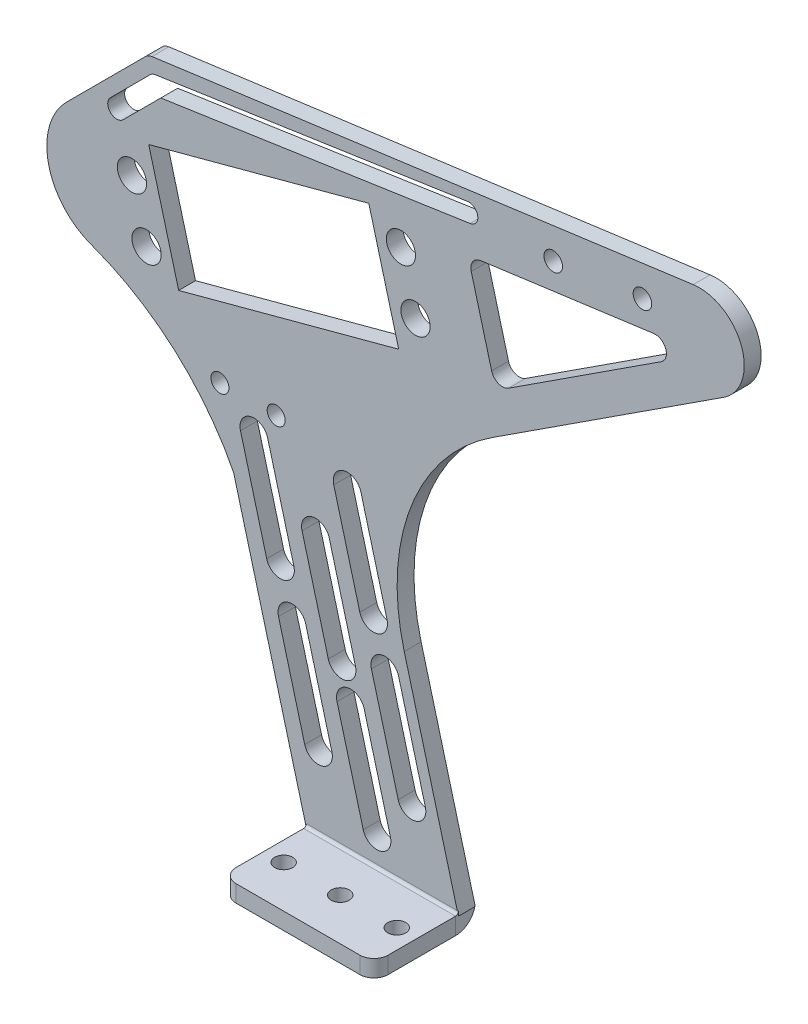
from build123d import *

# Parameters (mm, degrees)
EXTRUDE_1_DEPTH              = 3
EXTRUDE_2_DEPTH              = 120
CUT_EXTRUDE_1_DEPTH          = 195.561044405
CUT_EXTRUDE_2_DEPTH          = 152.697989965
SKETCH_9_R                   = 0.555167329
CUT_EXTRUDE_3_DEPTH          = 10
HOLE_WIZARD_M5_1_D           = 4.2
HOLE_WIZARD_M5_1_DEPTH       = 12.4
HOLE_WIZARD_M5_1_CSINK_D     = 5.05
HOLE_WIZARD_M5_1_CSINK_ANGLE = 90
HOLE_WIZARD_M5_1_TIP         = 1.2618073
SKETCH_12_R                  = 0.419228838
SKETCH_12_R_2                = 0.457437139
CUT_EXTRUDE_4_DEPTH          = 10
HOLE_WIZARD_M3_1_D           = 2.5
HOLE_WIZARD_M3_1_DEPTH       = 7.5
HOLE_WIZARD_M3_1_CSINK_D     = 3.05
HOLE_WIZARD_M3_1_CSINK_ANGLE = 90
HOLE_WIZARD_M3_1_TIP         = 0.751075774
SKETCH_31_W                  = 27
SKETCH_31_H                  = 3
CUT_EXTRUDE_7_DEPTH          = 18
SM_BASE_FLANGE_4_DEPTH       = 27
CUT_EXTRUDE_8_DEPTH          = 18
SKETCH_42_R                  = 1.6
SKETCH_42_R_2                = 2.6
CUT_EXTRUDE_9_DEPTH          = 18
SKETCH_43_R                  = 1.65
CUT_EXTRUDE_10_DEPTH         = 18
CUT_EXTRUDE_11_DEPTH         = 10
CUT_EXTRUDE_12_DEPTH         = 152.697989965
CUT_EXTRUDE_13_DEPTH         = 152.697989965


# Sheet-metal steps are written as plain solids
with BuildPart() as part:
    # 草图2 → 凸台-拉伸1 (new body)
    with BuildSketch(Plane(origin=(0, 0, 0), x_dir=(1, 0, 0), z_dir=(0, 1, 0))):
        with BuildLine():
            Line((0, 0), (27, 0))
            Line((27, 0), (27, -16))
            ThreePointArc((27, -16), (26.414213562, -17.414213562), (25, -18))
            Line((25, -18), (2, -18))
            ThreePointArc((2, -18), (0.585786438, -17.414213562), (0, -16))
            Line((0, -16), (0, 0))
        make_face()
    extrude(amount=EXTRUDE_1_DEPTH)

    # 草图3 → 凸台-拉伸2 (add)
    with BuildSketch(Plane(origin=(0, 3, 0), x_dir=(1, 0, 0), z_dir=(0, 1, 0))):
        Polygon((0, 0), (150, 0), (150, -3), (-100, -3), (-100, 0), align=None)
    extrude(amount=EXTRUDE_2_DEPTH)

    # 草图4 → 切除-拉伸1 (cut, through all)
    with BuildSketch(Plane.XY.offset(3)):
        with BuildLine():
            Line((-27.465625599, 108.090395999), (81.955038276, 122.874558425))
            ThreePointArc((81.955038276, 122.874558425), (87.311898998, 119.659835192), (85.350748847, 113.728200311))
            Line((85.350748847, 113.728200311), (33.001315422, 79.678206183))
            ThreePointArc((33.001315422, 79.678206183), (18.570908538, 61.838352676), (17.374177378, 38.924059091))
            Line((17.374177378, 38.924059091), (27, 3))
            Line((27, 3), (150, 3))
            Line((150, 3), (150, 123))
            Line((150, 123), (-100, 123))
            Line((-100, 123), (-100, 3))
            Line((-100, 3), (0, 3))
            Line((0, 3), (-12.940952255, 51.296291314))
            ThreePointArc((-12.940952255, 51.296291314), (-23.474992402, 64.922058411), (-38.267104772, 73.743676313))
            ThreePointArc((-38.267104772, 73.743676313), (-45.866257029, 82.424841396), (-42.634405947, 93.500259258))
            Line((-42.634405947, 93.500259258), (-28.612046307, 107.522618899))
            ThreePointArc((-28.612046307, 107.522618899), (-28.085458288, 107.900644409), (-27.465625599, 108.090395999))
        make_face()
    extrude(amount=-CUT_EXTRUDE_1_DEPTH, mode=Mode.SUBTRACT)

    # Sketch 8 → 切除-拉伸2 (cut, through all)
    with BuildSketch(Plane.XY.offset(3)):
        with BuildLine():
            Line((11.543452853, 33.329610255), (16.299102923, 15.581282572))
            ThreePointArc((16.299102923, 15.581282572), (19.360965101, 13.813515619), (21.128732054, 16.875377797))
            Line((21.128732054, 16.875377797), (16.373081985, 34.623705481))
            ThreePointArc((16.373081985, 34.623705481), (13.311219806, 36.391472434), (11.543452853, 33.329610255))
        make_face()
        with BuildLine():
            Line((-11.73043783, 58.369699894), (-7.071695019, 40.983035021))
            ThreePointArc((-7.071695019, 40.983035021), (-4.00983284, 39.215268068), (-2.242065887, 42.277130246))
            Line((-2.242065887, 42.277130246), (-6.900808699, 59.663795119))
            ThreePointArc((-6.900808699, 59.663795119), (-9.962670878, 61.431562072), (-11.73043783, 58.369699894))
        make_face()
        with BuildLine():
            Line((-4.972512404, 33.14877885), (-0.313769593, 15.762113977))
            ThreePointArc((-0.313769593, 15.762113977), (2.748092586, 13.994347024), (4.515859539, 17.056209202))
            Line((4.515859539, 17.056209202), (-0.142883273, 34.442874076))
            ThreePointArc((-0.142883273, 34.442874076), (-3.204745451, 36.210641028), (-4.972512404, 33.14877885))
        make_face()
        with BuildLine():
            Line((-0.784084289, 48.426978761), (3.876036229, 31.035172218))
            ThreePointArc((3.876036229, 31.035172218), (6.937898407, 29.267405265), (8.70566536, 32.329267444))
            Line((8.70566536, 32.329267444), (4.045544842, 49.721073986))
            ThreePointArc((4.045544842, 49.721073986), (0.983682664, 51.488840939), (-0.784084289, 48.426978761))
        make_face()
        with BuildLine():
            Line((4.846248155, 58.323918457), (9.480456769, 41.028816457))
            ThreePointArc((9.480456769, 41.028816457), (12.542318947, 39.261049504), (14.3100859, 42.322911683))
            Line((14.3100859, 42.322911683), (9.675877286, 59.618013683))
            ThreePointArc((9.675877286, 59.618013683), (6.614015108, 61.385780636), (4.846248155, 58.323918457))
        make_face()
        with BuildLine():
            Line((5.4289505, 25.23961726), (10.087693311, 7.852952387))
            ThreePointArc((10.087693311, 7.852952387), (13.14955549, 6.085185434), (14.917322443, 9.147047613))
            Line((14.917322443, 9.147047613), (10.258579631, 26.533712486))
            ThreePointArc((10.258579631, 26.533712486), (7.196717453, 28.301479439), (5.4289505, 25.23961726))
        make_face()
    extrude(amount=-CUT_EXTRUDE_2_DEPTH, mode=Mode.SUBTRACT)

    # 草图9 → 切除-拉伸3 (cut)
    with BuildSketch(Plane.XY.offset(3)):
        with Locations((-28.427787155, 78.364928444)):
            Circle(SKETCH_9_R)
        with Locations((-31.021767983, 88.02263332)):
            Circle(SKETCH_9_R)
        with Locations((19.37785198, 91.205133539)):
            Circle(SKETCH_9_R)
        with Locations((16.783871152, 100.862838415)):
            Circle(SKETCH_9_R)
        Polygon((-22.719980027, 74.461924756), (-28.037640723, 94.260219752), (11.076064024, 104.765842103), (16.39372472, 84.967547107), align=None)
    extrude(amount=-CUT_EXTRUDE_3_DEPTH, mode=Mode.SUBTRACT)

    # M5 螺纹孔1
    with Locations(Plane.XY.offset(3)):
        with Locations((-31.021767983, 88.02263332), (-28.427787155, 78.364928444), (16.783871152, 100.862838415), (19.37785198, 91.205133539)):
            CounterSinkHole(HOLE_WIZARD_M5_1_D / 2, HOLE_WIZARD_M5_1_CSINK_D / 2, depth=HOLE_WIZARD_M5_1_DEPTH, counter_sink_angle=HOLE_WIZARD_M5_1_CSINK_ANGLE)
            with Locations((0, 0, -(HOLE_WIZARD_M5_1_DEPTH + HOLE_WIZARD_M5_1_TIP / 2))):  # 118° drill point
                Cone(0, HOLE_WIZARD_M5_1_D / 2, HOLE_WIZARD_M5_1_TIP, mode=Mode.SUBTRACT)

    # 草图12 → 切除-拉伸4 (cut)
    with BuildSketch(Plane.XY.offset(3)):
        with Locations((-5.383085829, 63.900528175)):
            Circle(SKETCH_12_R)
        with Locations((-15.383085829, 63.900528175)):
            Circle(SKETCH_12_R_2)
        Polygon((-27.731348581, 94.083626651), (10.899470923, 104.45954996), (16.087432577, 85.144140208), (-22.543386926, 74.768216899), align=None)
    extrude(amount=-CUT_EXTRUDE_4_DEPTH, mode=Mode.SUBTRACT)

    # M3 螺纹孔1
    with Locations(Plane.XY.offset(3)):
        with Locations((-15.383085829, 63.900528175), (-5.383085829, 63.900528175)):
            CounterSinkHole(HOLE_WIZARD_M3_1_D / 2, HOLE_WIZARD_M3_1_CSINK_D / 2, depth=HOLE_WIZARD_M3_1_DEPTH, counter_sink_angle=HOLE_WIZARD_M3_1_CSINK_ANGLE)
            with Locations((0, 0, -(HOLE_WIZARD_M3_1_DEPTH + HOLE_WIZARD_M3_1_TIP / 2))):  # 118° drill point
                Cone(0, HOLE_WIZARD_M3_1_D / 2, HOLE_WIZARD_M3_1_TIP, mode=Mode.SUBTRACT)

    # 草图31 → 切除-拉伸7 (cut)
    with BuildSketch(Plane(origin=(0, 0, 0), x_dir=(-1, 0, 0), z_dir=(0, 0, -1))):
        with Locations((-13.5, 1.5)):
            Rectangle(SKETCH_31_W, SKETCH_31_H)
    extrude(amount=-CUT_EXTRUDE_7_DEPTH, mode=Mode.SUBTRACT)

    # 草图42 → 切除-拉伸9 (cut)
    with BuildSketch(Plane.XY.offset(3)):
        with Locations((-15.383085829, 63.900528175)):
            Circle(SKETCH_42_R)
        with Locations((-5.383085829, 63.900528175)):
            Circle(SKETCH_42_R)
        with Locations((-28.427787155, 78.364928444)):
            Circle(SKETCH_42_R_2)
        with Locations((-31.021767983, 88.02263332)):
            Circle(SKETCH_42_R_2)
        with Locations((16.783871152, 100.862838415)):
            Circle(SKETCH_42_R_2)
        with Locations((19.37785198, 91.205133539)):
            Circle(SKETCH_42_R_2)
    extrude(amount=-CUT_EXTRUDE_9_DEPTH, mode=Mode.SUBTRACT)

    # 草图43 → 切除-拉伸10 (cut)
    with BuildSketch(Plane.XY.offset(3)):
        with Locations((43.853289388, 112.252662001)):
            Circle(SKETCH_43_R)
        with Locations((59.70921469, 114.395004835)):
            Circle(SKETCH_43_R)
        with BuildLine():
            Line((-34.854948443, 98.060205677), (-27.783880632, 105.131273489))
            ThreePointArc((-27.783880632, 105.131273489), (-27.372130398, 105.428939436), (-26.887815625, 105.582505293))
            Line((-26.887815625, 105.582505293), (28.617983545, 113.835264655))
            ThreePointArc((28.617983545, 113.835264655), (30.435892042, 112.487967844), (29.088595231, 110.670059347))
            Line((29.088595231, 110.670059347), (-25.894680467, 102.494990254))
            Line((-25.894680467, 102.494990254), (-32.592206744, 95.797463977))
            ThreePointArc((-32.592206744, 95.797463977), (-34.854948443, 95.797463977), (-34.854948443, 98.060205677))
        make_face()
    extrude(amount=-CUT_EXTRUDE_10_DEPTH, mode=Mode.SUBTRACT)

    # 草图45 → 切除-拉伸12 (cut, through all)
    with BuildSketch(Plane.XY.offset(3)):
        with BuildLine():
            Line((30.943691051, 105.891393518), (61.704894996, 110.047634391))
            ThreePointArc((61.704894996, 110.047634391), (63.847639285, 108.761745098), (63.063179225, 106.389091146))
            Line((63.063179225, 106.389091146), (35.926478804, 88.738384548))
            ThreePointArc((35.926478804, 88.738384548), (34.120486844, 88.547302554), (32.904446455, 89.896140965))
            Line((32.904446455, 89.896140965), (29.27994293, 103.39060669))
            ThreePointArc((29.27994293, 103.39060669), (29.546325951, 105.017215559), (30.943691051, 105.891393518))
        make_face()
    extrude(amount=-CUT_EXTRUDE_12_DEPTH, mode=Mode.SUBTRACT)

    # 草图46 → 切除-拉伸13 (cut, through all)
    with BuildSketch(Plane.XY.offset(3)):
        with BuildLine():
            Line((85.350748847, 113.728200311), (74.167295897, 106.45407178))
            ThreePointArc((74.167295897, 106.45407178), (77.30513614, 115.944687589), (68.734158983, 121.088244762))
            Line((68.734158983, 121.088244762), (81.955038276, 122.874558425))
            ThreePointArc((81.955038276, 122.874558425), (87.311898998, 119.659835192), (85.350748847, 113.728200311))
        make_face()
    extrude(amount=-CUT_EXTRUDE_13_DEPTH, mode=Mode.SUBTRACT)


with BuildPart() as body_2:
    # 草图32 → 基体-法兰4 (new body)
    with BuildSketch(Plane(origin=(0, 0, 0), x_dir=(0, 0, -1), z_dir=(1, 0, 0))):
        with BuildLine():
            Line((0, 4.254616755), (0, 3.754616755))
            ThreePointArc((0, 3.754616755), (-1.025126266, 1.279743021), (-3.5, 0.254616755))
            Line((-3.5, 0.254616755), (-18, 0.254616755))
            Line((-18, 0.254616755), (-18, 3.254616755))
            Line((-18, 3.254616755), (-3.5, 3.254616755))
            ThreePointArc((-3.5, 3.254616755), (-3.146446609, 3.401063365), (-3, 3.754616755))
            Line((-3, 3.754616755), (-3, 4.254616755))
            Line((-3, 4.254616755), (0, 4.254616755))
        make_face()
    extrude(amount=SM_BASE_FLANGE_4_DEPTH)

    # 草图41 → 切除-拉伸8 (cut)
    with BuildSketch(Plane.XY.offset(3)):
        Polygon((27, 3), (27, 4.254616755), (26.663826454, 4.254616755), align=None)
    extrude(amount=-CUT_EXTRUDE_8_DEPTH, mode=Mode.SUBTRACT)

    # 草图44 → 切除-拉伸11 (cut)
    with BuildSketch(Plane(origin=(0, 3.254616755, 0), x_dir=(1, 0, 0), z_dir=(0, 1, 0))):
        with BuildLine():
            ThreePointArc((5.05, -10.5), (3.45, -8.9), (1.85, -10.5))
            Line((1.85, -10.5), (5.05, -10.5))
        make_face()
        with BuildLine():
            Line((5.05, -10.5), (1.85, -10.5))
            ThreePointArc((1.85, -10.5), (3.45, -12.1), (5.05, -10.5))
        make_face()
        with BuildLine():
            Line((0, -15.5), (0, -18))
            Line((0, -18), (2.5, -18))
            ThreePointArc((2.5, -18), (0.732233047, -17.267766953), (0, -15.5))
        make_face()
        with BuildLine():
            ThreePointArc((21.95, -10.5), (23.55, -12.1), (25.15, -10.5))
            Line((25.15, -10.5), (21.95, -10.5))
        make_face()
        with BuildLine():
            Line((21.95, -10.5), (25.15, -10.5))
            ThreePointArc((25.15, -10.5), (23.55, -8.9), (21.95, -10.5))
        make_face()
        with BuildLine():
            ThreePointArc((15.1, -10.5), (13.5, -8.9), (11.9, -10.5))
            Line((11.9, -10.5), (15.1, -10.5))
        make_face()
        with BuildLine():
            Line((15.1, -10.5), (11.9, -10.5))
            ThreePointArc((11.9, -10.5), (13.5, -12.1), (15.1, -10.5))
        make_face()
        with BuildLine():
            ThreePointArc((27, -15.5), (26.267766953, -17.267766953), (24.5, -18))
            Line((24.5, -18), (27, -18))
            Line((27, -18), (27, -15.5))
        make_face()
    extrude(amount=-CUT_EXTRUDE_11_DEPTH, mode=Mode.SUBTRACT)


with BuildPart() as part_1:
    add(part.part)

    # Combine 1: union body 2
    add(body_2.part)


solid = part_1.part
